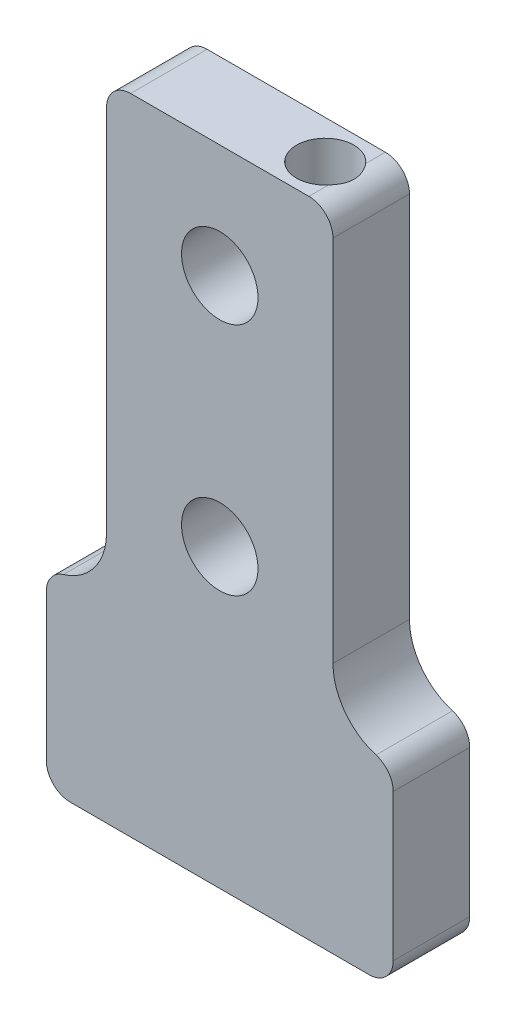
from build123d import *

# Parameters (mm, degrees)
SKETCH1_R           = 3.175
BOSS_EXTRUDE1_DEPTH = 6.35
SKETCH2_R           = 2.38125
CUT_EXTRUDE2_DEPTH  = 56.721163959
FILLET1_R           = 2


with BuildPart() as part:
    # Sketch1 → Boss-Extrude1 (new body)
    with BuildSketch(Plane.XY):
        with BuildLine():
            Line((9.398, -3.7), (9.398, 28.878))
            Line((9.398, 28.878), (-9.398, 28.878))
            Line((-9.398, 28.878), (-9.398, -3.7))
            ThreePointArc((-9.398, -3.7), (-10.862466094, -7.235533906), (-14.398, -8.7))
            Line((-14.398, -8.7), (-14.398, -24.575))
            Line((-14.398, -24.575), (14.398, -24.575))
            Line((14.398, -24.575), (14.398, -8.7))
            ThreePointArc((14.398, -8.7), (10.862466094, -7.235533906), (9.398, -3.7))
        make_face()
        Circle(SKETCH1_R, mode=Mode.SUBTRACT)
        with Locations((0, 19.48)):
            Circle(SKETCH1_R, mode=Mode.SUBTRACT)
    extrude(amount=-BOSS_EXTRUDE1_DEPTH)

    # Sketch2 → Cut-Extrude2 (cut, through all)
    with BuildSketch(Plane(origin=(0, 28.878, 0), x_dir=(1, 0, 0), z_dir=(0, 1, 0))):
        with Locations(Location((5.58125, 3.175, 0), (0, 0, 270))):
            Circle(SKETCH2_R)
    extrude(amount=-CUT_EXTRUDE2_DEPTH, mode=Mode.SUBTRACT)

    # Fillet1
    # the kernel refuses this fillet: 2 mm, written as the material it takes off along each edge
    with BuildSketch(Plane(origin=(-9.398, 28.878, 5), x_dir=(1, 0, 0), z_dir=(0, 0, -1)), Plane(origin=(9.398, 28.878, 5), x_dir=(0, -1, 0), z_dir=(0, 0, -1)), Plane(origin=(-14.398, -24.575, 5), x_dir=(0, 1, 0), z_dir=(0, 0, -1))) as fillet1_piece_1:
        with BuildLine():
            CenterArc((FILLET1_R, FILLET1_R), FILLET1_R, 180, 90)
            Line((0, FILLET1_R), (0, 0))
            Line((0, 0), (FILLET1_R, 0))
        make_face()
    extrude(amount=16.35, mode=Mode.SUBTRACT)
    with BuildSketch(Plane(origin=(14.398, -8.7, 4.270509831), x_dir=(-0.9895238368781003, 0.14436958214957393, 0), z_dir=(0, 0, -1))) as fillet1_piece_2:
        with BuildLine():
            CenterArc((1.732434986, -1.979047674), FILLET1_R, 98.3007748, 73.398450401)
            Line((-0.246612688, -1.690308509), (0, 0))
            ThreePointArc((0, 0), (0.721847911, -0.052380816), (1.443695821, 0))
        make_face()
    extrude(amount=14.891019662, mode=Mode.SUBTRACT)
    with BuildSketch(Plane(origin=(14.398, -24.575, 5), x_dir=(0, 1, 0), z_dir=(0, 0, -1))) as fillet1_piece_3:
        with BuildLine():
            CenterArc((FILLET1_R, -FILLET1_R), FILLET1_R, 90, 90)
            Line((0, -FILLET1_R), (0, 0))
            Line((0, 0), (FILLET1_R, 0))
        make_face()
    extrude(amount=16.35, mode=Mode.SUBTRACT)
    with BuildSketch(Plane(origin=(-14.398, -8.7, 4.270509831), x_dir=(0.9895238368781003, 0.14436958214957393, 0), z_dir=(0, 0, -1))) as fillet1_piece_4:
        with BuildLine():
            CenterArc((1.732434986, 1.979047674), FILLET1_R, 188.300774799, 73.398450401)
            Line((-0.246612688, 1.690308509), (0, 0))
            ThreePointArc((0, 0), (0.721847911, 0.052380816), (1.443695821, 0))
        make_face()
    extrude(amount=14.891019662, mode=Mode.SUBTRACT)


solid = part.part
